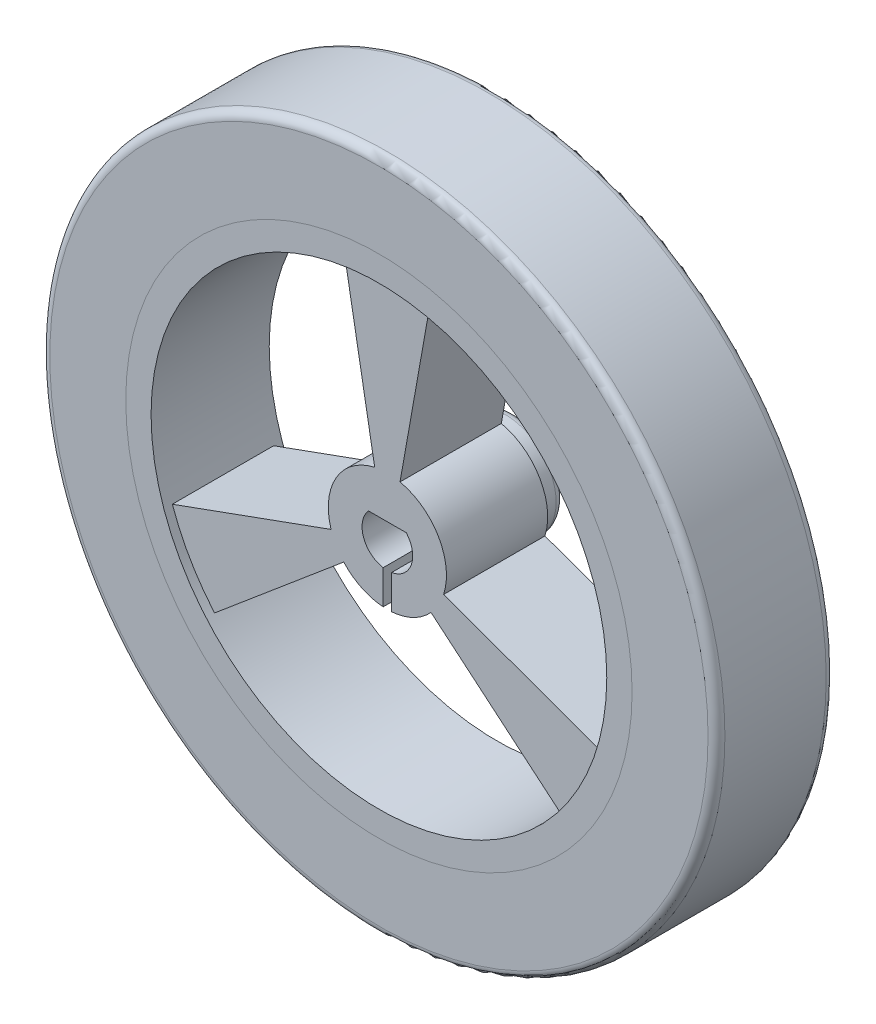
from build123d import *
from build123d.topology import SkipClean

# Parameters (mm, degrees)
ODEBRAT_VYSUNUT_M1_DEPTH = 27.537709019
ODEBRAT_VYSUNUT_M2_DEPTH = 27.537709019


with BuildPart() as part:
    # Skica2 → Rotovat1 (revolve)
    with BuildSketch(Plane(origin=(0, 0, 0), x_dir=(0, 0, -1), z_dir=(1, 0, 0))):
        with BuildLine():
            Line((-3, 13.5), (-3, 0))
            Line((-3, 0), (4.5, 0))
            Line((4.5, 0), (4.5, 2.5))
            ThreePointArc((4.5, 2.5), (4.353553391, 2.853553391), (4, 3))
            Line((4, 3), (3, 3))
            Line((3, 3), (3, 13.5))
            Line((3, 13.5), (3.5, 13.5))
            Line((3.5, 13.5), (3.5, 15))
            Line((3.5, 15), (2, 15))
            Line((2, 15), (2, 18))
            Line((2, 18), (-2, 18))
            Line((-2, 18), (-2, 15))
            Line((-2, 15), (-3.5, 15))
            Line((-3.5, 15), (-3.5, 13.5))
            Line((-3.5, 13.5), (-3, 13.5))
        make_face()
    revolve(axis=Axis((0, 0, 36.988949001), (0, 0, -1)))

    # Skica3 → Odebrat vysunutím1 (cut, through all)
    with SkipClean():  # the faces are left unmerged after this step: merging them gives an invalid solid
        with BuildSketch(Plane.XY.offset(3)):
            with BuildLine():
                Line((12.739125293, -4.468186071), (3.335679821, -1.059830239))
                ThreePointArc((3.335679821, -1.059830239), (3.031088913, 1.75), (0.75, 3.418698583))
                Line((0.75, 3.418698583), (2.5, 13.266499161))
                ThreePointArc((2.5, 13.266499161), (11.691342951, 6.75), (12.739125293, -4.468186071))
            make_face()
            with BuildLine():
                Line((-2.5, 13.266499161), (-0.75, 3.418698583))
                ThreePointArc((-0.75, 3.418698583), (-3.031088913, 1.75), (-3.335679821, -1.059830239))
                Line((-3.335679821, -1.059830239), (-12.739125293, -4.468186071))
                ThreePointArc((-12.739125293, -4.468186071), (-11.691342951, 6.75), (-2.5, 13.266499161))
            make_face()
            with BuildLine():
                Line((10.239125293, -8.79831309), (2.585679821, -2.358868344))
                ThreePointArc((2.585679821, -2.358868344), (0, -3.5), (-2.585679821, -2.358868344))
                Line((-2.585679821, -2.358868344), (-10.239125293, -8.79831309))
                ThreePointArc((-10.239125293, -8.79831309), (0, -13.5), (10.239125293, -8.79831309))
            make_face()
        extrude(amount=-ODEBRAT_VYSUNUT_M1_DEPTH, mode=Mode.SUBTRACT)

    # Skica4 → Odebrat vysunutím2 (cut, through all)
    with SkipClean():  # the faces are left unmerged after this step: merging them gives an invalid solid
        with BuildSketch(Plane.XY.offset(3)):
            with BuildLine():
                Line((-1.118033989, 1), (1.118033989, 1))
                ThreePointArc((1.118033989, 1), (1.41572039, -0.495717438), (0.25, -1.479019946))
                Line((0.25, -1.479019946), (0.25, -4.832561127))
                Line((0.25, -4.832561127), (-0.25, -4.832561127))
                Line((-0.25, -4.832561127), (-0.25, -1.479019946))
                ThreePointArc((-0.25, -1.479019946), (-1.41572039, -0.495717438), (-1.118033989, 1))
            make_face()
        extrude(amount=-ODEBRAT_VYSUNUT_M2_DEPTH, mode=Mode.SUBTRACT)


with BuildPart() as body_2:
    # Skica5 → Rotovat2 (revolve)
    with BuildSketch(Plane(origin=(0, 0, 0), x_dir=(0, 0, -1), z_dir=(1, 0, 0))):
        with BuildLine():
            Line((-3.5, 15), (-3.5, 19.5))
            ThreePointArc((-3.5, 19.5), (-3.353553391, 19.853553391), (-3, 20))
            Line((-3, 20), (3, 20))
            ThreePointArc((3, 20), (3.353553391, 19.853553391), (3.5, 19.5))
            Line((3.5, 19.5), (3.5, 15))
            Line((3.5, 15), (2, 15))
            Line((2, 15), (2, 18))
            Line((2, 18), (-2, 18))
            Line((-2, 18), (-2, 15))
            Line((-2, 15), (-3.5, 15))
        make_face()
    revolve(axis=Axis((0, 0, 0), (0, 0, -1)))


solid = Compound([part.part, body_2.part])
